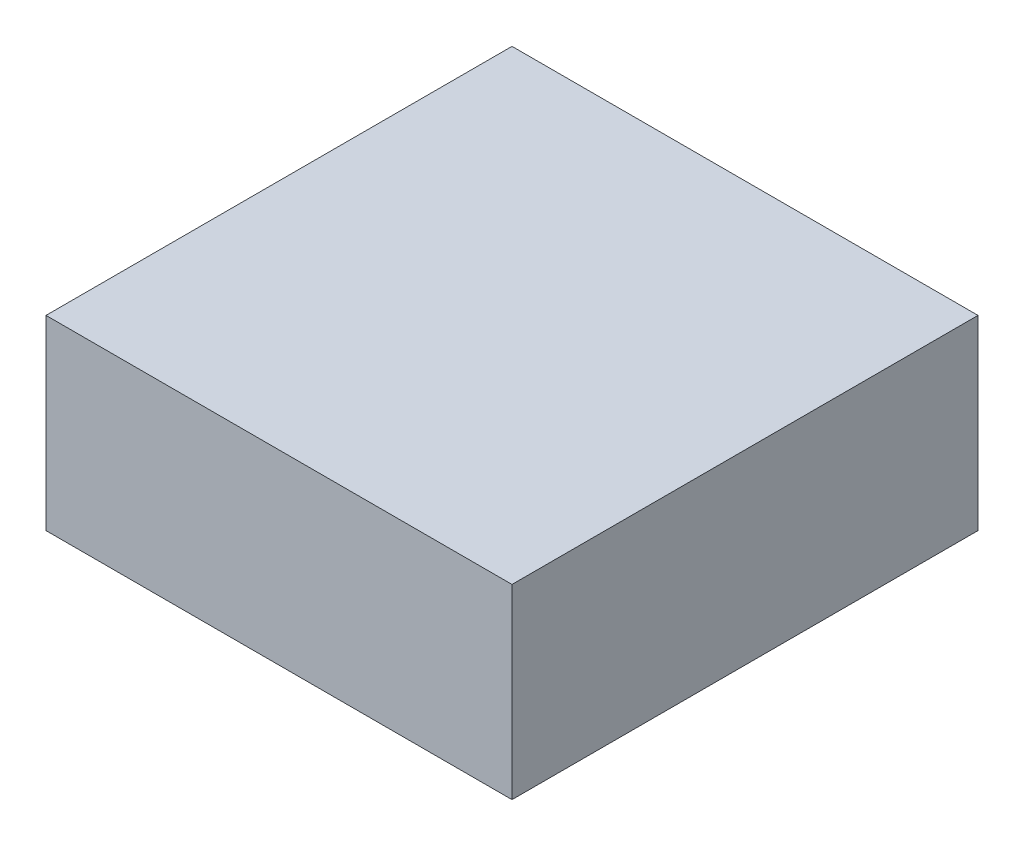
from build123d import *

# Parameters (mm, degrees)
SKETCH1_W           = 130
SKETCH1_H           = 130
BOSS_EXTRUDE1_DEPTH = 52


with BuildPart() as part:
    # Sketch1 → Boss-Extrude1 (new body)
    with BuildSketch(Plane(origin=(0, 0, 0), x_dir=(1, 0, 0), z_dir=(0, 1, 0))):
        Rectangle(SKETCH1_W, SKETCH1_H)
    extrude(amount=BOSS_EXTRUDE1_DEPTH)


solid = part.part
